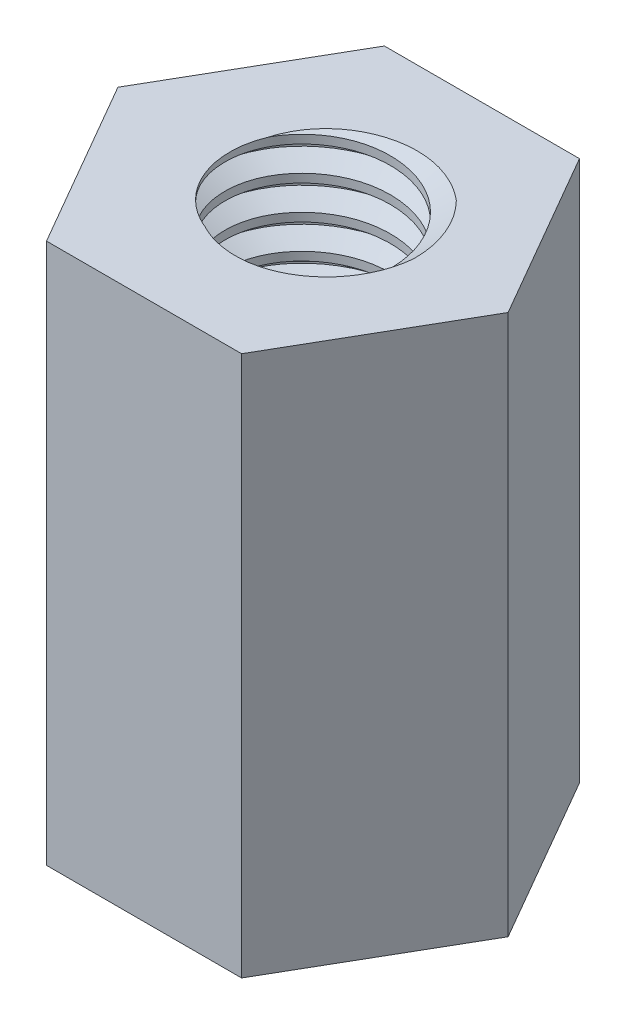
from build123d import *

# Parameters (mm, degrees)
BOSS_EXTRUDE1_DEPTH = 8
SKETCH2_R           = 1.5
CUT_EXTRUDE2_DEPTH  = 8
THREAD1_PITCH       = 0.5
SKETCH17_W          = 9.832822672
SKETCH17_H          = 11.885845015
CUT_EXTRUDE3_DEPTH  = 8


with BuildPart() as part:
    # Sketch1 → Boss-Extrude1 (new body)
    with BuildSketch(Plane(origin=(0, 0, 0), x_dir=(1, 0, 0), z_dir=(0, 1, 0))):
        Polygon((2.886751346, 0), (1.443375673, 2.5), (-1.443375673, 2.5), (-2.886751346, 0), (-1.443375673, -2.5), (1.443375673, -2.5), align=None)
    extrude(amount=BOSS_EXTRUDE1_DEPTH)

    # Sketch2 → Cut-Extrude2 (cut)
    with BuildSketch(Plane(origin=(0, 0, 0), x_dir=(1, 0, 0), z_dir=(0, 1, 0))):
        with Locations(Location((0, 0, 0), (0, 0, 270))):
            Circle(SKETCH2_R)
    extrude(amount=CUT_EXTRUDE2_DEPTH, mode=Mode.SUBTRACT)

    # Thread1: the profile of Thread Profile3 profile screwed along a right-hand helix of 16 turns, 6 arcs to a turn; built about Z, then put on its axis
    thread1_z = Axis((0, 0, 0), (0, 0, 1))
    thread1_corners = [(1.5003, 0, -0.000173205), (1.5003, 0, 0.437673204), (1.229367063, 0, 0.281249999), (1.229367063, 0, 0.156249999)]
    with BuildLine(mode=Mode.PRIVATE) as thread1_profile:
        Line(thread1_corners[0], thread1_corners[1])
        Line(thread1_corners[1], thread1_corners[2])
        Line(thread1_corners[2], thread1_corners[3])
        Line(thread1_corners[3], thread1_corners[0])
    thread1_cap = Face(thread1_profile.wire())
    thread1_turn_angles = [0, 30, 60, 90, 120, 150, 180, 210, 240, 270, 300, 330, 360]
    thread1_turn_weights = [1, 0.8660254037844387, 1, 0.8660254037844387, 1, 0.8660254037844387, 1, 0.8660254037844387, 1, 0.8660254037844387, 1, 0.8660254037844387, 1]
    thread1_turn_rails = [Edge.make_bspline([Vector(p[0], p[1], 0).rotate(thread1_z, thread1_turn_angles[k]) / thread1_turn_weights[k] + Vector(0, 0, p[2] + THREAD1_PITCH * thread1_turn_angles[k] / 360) for k in range(13)], [0, 0, 0, 1, 1, 2, 2, 3, 3, 4, 4, 5, 5, 6, 6, 6], 2, thread1_turn_weights) for p in thread1_corners]
    thread1_turn_sides = [Face.make_surface_from_curves(thread1_turn_rails[p[0]], thread1_turn_rails[p[1]]) for p in [(0, 1), (1, 2), (2, 3), (3, 0)]]
    thread1 = Plane(origin=(0, 0, 0), x_dir=(1, 0, 0), z_dir=(0, 1, 0)) * Solid(Shell([*[p.moved(Location((0, 0, THREAD1_PITCH * i))) for i in range(16) for p in thread1_turn_sides], thread1_cap, thread1_cap.rotate(thread1_z, 5760).moved(Location((0, 0, THREAD1_PITCH * 5760 / 360)))]))
    add(thread1)

    # Sketch17 → Cut-Extrude3 (cut)
    with BuildSketch(Plane(origin=(0, 8, 0), x_dir=(1, 0, 0), z_dir=(0, 1, 0))):
        with Locations((-0.729506953, -0.100597648)):
            Rectangle(SKETCH17_W, SKETCH17_H)
    extrude(amount=CUT_EXTRUDE3_DEPTH, mode=Mode.SUBTRACT)


solid = part.part
